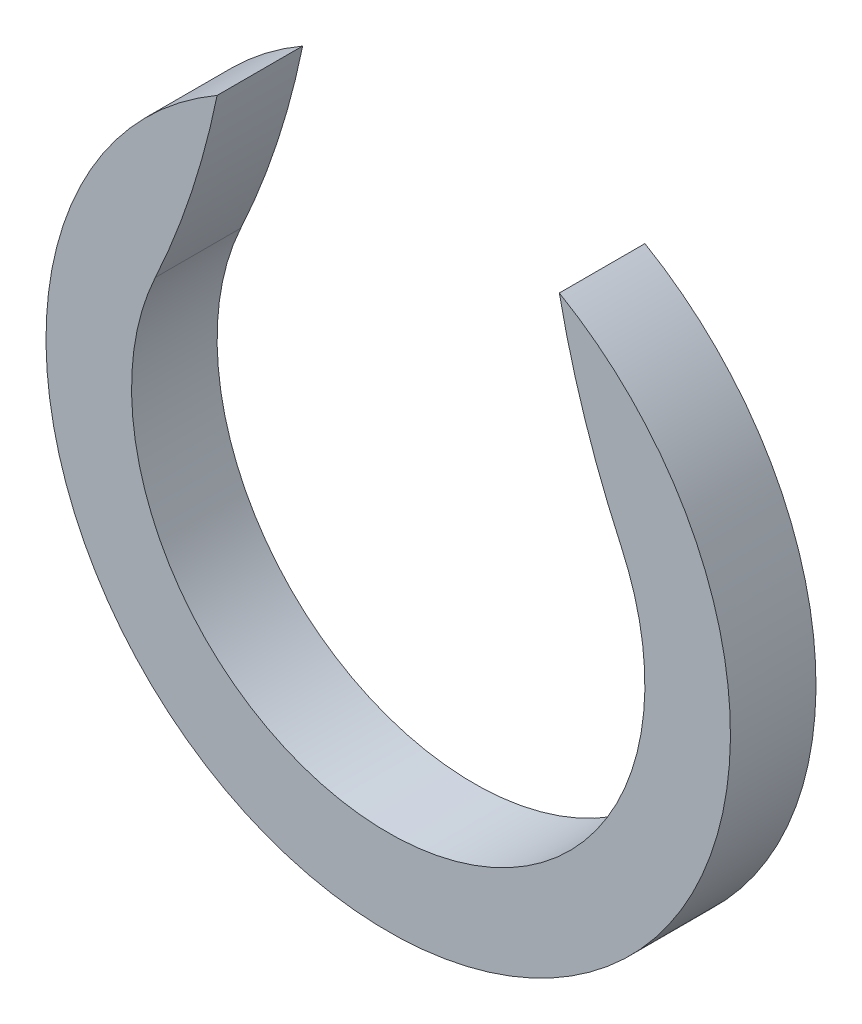
from build123d import *

# Parameters (mm, degrees)
RESSALTO_EXTRUS_O1_DEPTH = 1
FILETE1_R                = 10


with BuildPart() as part:
    # Esboço1 → Ressalto-extrusão1 (new body)
    with BuildSketch(Plane.XY):
        with BuildLine():
            Line((-2, 2.236067977), (-2, 3.464101615))
            ThreePointArc((-2, 3.464101615), (0, -4), (2, 3.464101615))
            Line((2, 3.464101615), (2, 2.236067977))
            ThreePointArc((2, 2.236067977), (0, -3), (-2, 2.236067977))
        make_face()
    extrude(amount=RESSALTO_EXTRUS_O1_DEPTH)

    # Filete1
    # the kernel refuses this fillet: 10 mm, written as the material it takes off along each edge
    with BuildSketch(Plane(origin=(2, 2.236067977, -3.070084094), x_dir=(0, 1, 0), z_dir=(0, 0, 1))) as filete1_piece_1:
        with BuildLine():
            CenterArc((3.220142371, -9.79956646), FILETE1_R, 101.490816856, 13.325367656)
            Line((-0.976942512, -0.722976875), (-1.06088421, -0.541445084))
            ThreePointArc((-1.06088421, -0.541445084), (-0.570448886, -0.250713896), (-0.149071199, 0.133333333))
            Line((-0.149071199, 0.133333333), (0, 0.2))
            ThreePointArc((0, 0.2), (0.614016819, 0.2), (1.188191463, 0.195991329))
            Line((1.188191463, 0.195991329), (1.228033638, 0))
        make_face()
    extrude(amount=7.140168188, mode=Mode.SUBTRACT)
    with BuildSketch(Plane(origin=(-2, 2.236067977, -3.070084094), x_dir=(0, 1, 0), z_dir=(0, 0, 1))) as filete1_piece_2:
        with BuildLine():
            CenterArc((3.220142371, 9.79956646), FILETE1_R, 245.183815488, 13.325367656)
            Line((-0.976942512, 0.722976875), (-1.06088421, 0.541445084))
            ThreePointArc((-1.06088421, 0.541445084), (-0.570448886, 0.250713896), (-0.149071199, -0.133333333))
            Line((-0.149071199, -0.133333333), (0, -0.2))
            ThreePointArc((0, -0.2), (0.614016819, -0.2), (1.188191463, -0.195991329))
            Line((1.188191463, -0.195991329), (1.228033638, 0))
        make_face()
    extrude(amount=7.140168188, mode=Mode.SUBTRACT)


solid = part.part
